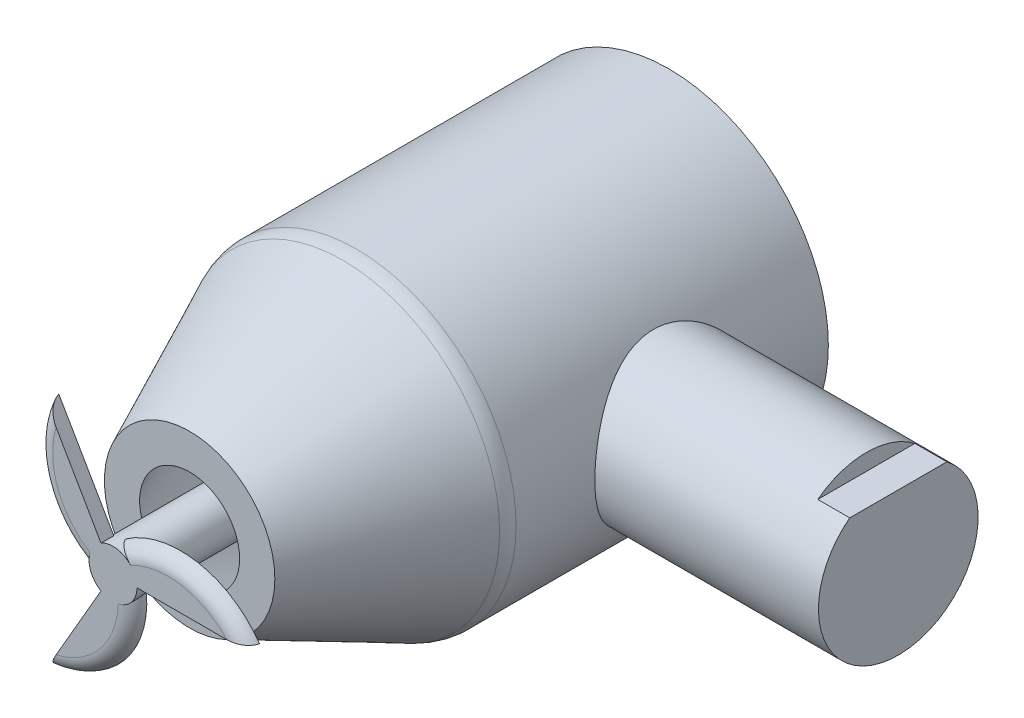
from build123d import *

# Parameters (mm, degrees)
SKETCH1_R                     = 50
BOSS_EXTRUDE1_DEPTH           = 100
BOSS_EXTRUDE1_OTHER_WAY_DEPTH = 50
BOSS_EXTRUDE1_OTHER_WAY_TAPER = 25
FILLET1_R                     = 10
SKETCH2_R                     = 7.5
BOSS_EXTRUDE2_DEPTH           = 160
SKETCH3_R                     = 7.5
BOSS_EXTRUDE3_DEPTH           = 4
FILLET2_R                     = 5
SKETCH4_R                     = 25
BOSS_EXTRUDE4_DEPTH           = 120
CUT_EXTRUDE2_START            = -10
CUT_EXTRUDE2_DEPTH            = 10


with BuildPart() as part:
    # Sketch1 → Boss-Extrude1 (new body)
    with BuildSketch(Plane.XY):
        Circle(SKETCH1_R)
    extrude(amount=-BOSS_EXTRUDE1_DEPTH)

    # Sketch1 → Boss-Extrude1 other way (add)
    with BuildSketch(Plane.XY):
        Circle(SKETCH1_R)
    extrude(amount=BOSS_EXTRUDE1_OTHER_WAY_DEPTH, taper=BOSS_EXTRUDE1_OTHER_WAY_TAPER)

    # Fillet1
    fillet1_edges = [part.edges().sort_by_distance(p)[0] for p in [
        (-50, 0, 0),
    ]]
    fillet(fillet1_edges, radius=FILLET1_R)

    # Shell2: read off the stored shape, not the designer's step
    # Shell2 outline → Shell2 (revolve, cut)
    with BuildSketch(Plane.XZ):
        Polygon((0, -90), (40, -90), (40, -2.216946626), (15.650837903, 50), (0, 50), align=None)
    revolve(axis=Axis((0, 0, 0), (0, 0, 1)), mode=Mode.SUBTRACT)

    # Sketch2 → Boss-Extrude2 (add)
    with BuildSketch(Plane.XY.offset(-90)):
        with Locations(Location((0, 0, 0), (0, 0, 180))):
            Circle(SKETCH2_R)
    extrude(amount=BOSS_EXTRUDE2_DEPTH)

    # Sketch3 → Boss-Extrude3 (add)
    with BuildSketch(Plane.XY.offset(70)):
        with BuildLine():
            ThreePointArc((0, 7.5), (5.303300859, 5.303300859), (7.5, 0))
            Line((7.5, 0), (41.895706174, 0))
            ThreePointArc((41.895706174, 0), (22.501153946, 12.426884851), (0, 7.5))
        make_face()
        with BuildLine():
            ThreePointArc((-6.495190528, -3.75), (-7.244443697, 1.941142838), (-3.75, 6.495190528))
            Line((-3.75, 6.495190528), (-20.947853087, 36.282745856))
            ThreePointArc((-20.947853087, 36.282745856), (-22.012574944, 13.273128506), (-6.495190528, -3.75))
        make_face()
        with BuildLine():
            ThreePointArc((-20.947853087, -36.282745856), (-0.488579002, -25.700013357), (6.495190528, -3.75))
            ThreePointArc((6.495190528, -3.75), (1.941142838, -7.244443697), (-3.75, -6.495190528))
            Line((-3.75, -6.495190528), (-20.947853087, -36.282745856))
        make_face()
        Circle(SKETCH3_R)
    extrude(amount=BOSS_EXTRUDE3_DEPTH)

    # Fillet2
    # the kernel refuses this fillet: 5 mm, written as the material it takes off along each edge
    with BuildSketch(Plane(origin=(17.197853087, -17.197853087, 74), x_dir=(0.979838516120554, 0.1997910967152214, 0), z_dir=(0.1997910967152214, -0.979838516120554, 0))) as fillet2_piece_1_section:
        with BuildLine():
            CenterArc((25.196702894, -5), FILLET2_R, 11.536959033, 78.463040967)
            Line((30.09568238, -4), (30.09568238, 0))
            Line((30.09568238, 0), (25.196702894, 0))
        make_face()
    fillet2_piece_1 = revolve(axis=Axis((17.197853087, -17.197853087, 74), (0, 0, 1)), revolution_arc=136.651808839, mode=Mode.PRIVATE)
    fillet2_piece_1 = fillet2_piece_1 - Plane(origin=(0, 0, 74), x_dir=(-1, 0, 0), z_dir=(0, 0, -1)) * Cylinder(7.5, 121, mode=Mode.PRIVATE)
    fillet2_piece_1 = split(fillet2_piece_1, bisect_by=Plane(origin=(17.197853087, 0, 74), z_dir=(0, 1, 0)), keep=Keep.TOP, mode=Mode.PRIVATE)
    add(fillet2_piece_1, mode=Mode.SUBTRACT)
    with BuildSketch(Plane(origin=(-23.492704207, -6.29485112, 74), x_dir=(-0.31689509285493905, -0.9484605949244596, 0), z_dir=(-0.9484605949244596, 0.31689509285493905, 0))) as fillet2_piece_2_section:
        with BuildLine():
            CenterArc((25.196702894, -5), FILLET2_R, 11.536959033, 78.463040967)
            Line((30.09568238, -4), (30.09568238, 0))
            Line((30.09568238, 0), (25.196702894, 0))
        make_face()
    fillet2_piece_2 = revolve(axis=Axis((-23.492704207, -6.29485112, 74), (0, 0, 1)), revolution_arc=136.651808839, mode=Mode.PRIVATE)
    fillet2_piece_2 = fillet2_piece_2 - Plane(origin=(0, 0, 74), x_dir=(-1, 0, 0), z_dir=(0, 0, -1)) * Cylinder(7.5, 121, mode=Mode.PRIVATE)
    fillet2_piece_2 = split(fillet2_piece_2, bisect_by=Plane(origin=(-8.598926543, -14.893777664, 74), z_dir=(0.8660254037844364, -0.500000000000004, 0)), keep=Keep.TOP, mode=Mode.PRIVATE)
    add(fillet2_piece_2, mode=Mode.SUBTRACT)
    with BuildSketch(Plane(origin=(6.29485112, 23.492704207, 74), x_dir=(-0.6629434232656098, 0.7486694982092396, 0), z_dir=(0.7486694982092396, 0.6629434232656098, 0))) as fillet2_piece_3_section:
        with BuildLine():
            CenterArc((25.196702894, -5), FILLET2_R, 11.536959033, 78.463040967)
            Line((25.196702894, 0), (30.09568238, 0))
            Line((30.09568238, 0), (30.09568238, -4))
        make_face()
    fillet2_piece_3 = revolve(axis=Axis((6.29485112, 23.492704207, 74), (0, 0, 1)), revolution_arc=136.651808839, mode=Mode.PRIVATE)
    fillet2_piece_3 = fillet2_piece_3 - Plane(origin=(0, 0, 74), x_dir=(-1, 0, 0), z_dir=(0, 0, -1)) * Cylinder(7.5, 121, mode=Mode.PRIVATE)
    fillet2_piece_3 = split(fillet2_piece_3, bisect_by=Plane(origin=(-8.598926543, 14.893777664, 74), z_dir=(-0.8660254037844434, -0.49999999999999206, 0)), keep=Keep.TOP, mode=Mode.PRIVATE)
    add(fillet2_piece_3, mode=Mode.SUBTRACT)

    # Sketch4 → Boss-Extrude4 (add)
    with BuildSketch(Plane(origin=(0, 0, 0), x_dir=(0, 0, -1), z_dir=(1, 0, 0))):
        with Locations(Location((51.895913136, 0, 0), (0, 0, 180))):
            Circle(SKETCH4_R)
    extrude(amount=BOSS_EXTRUDE4_DEPTH)

    # Sketch5 → Cut-Extrude2 (cut)
    with BuildSketch(Plane(origin=(120, 0, 0), x_dir=(0, 0, -1), z_dir=(1, 0, 0)).offset(CUT_EXTRUDE2_START)):
        with BuildLine():
            Line((36.699086206, 19.850855177), (67.092740066, 19.850855177))
            ThreePointArc((67.092740066, 19.850855177), (51.895913136, 25), (36.699086206, 19.850855177))
        make_face()
    extrude(amount=CUT_EXTRUDE2_DEPTH, mode=Mode.SUBTRACT)


solid = part.part
